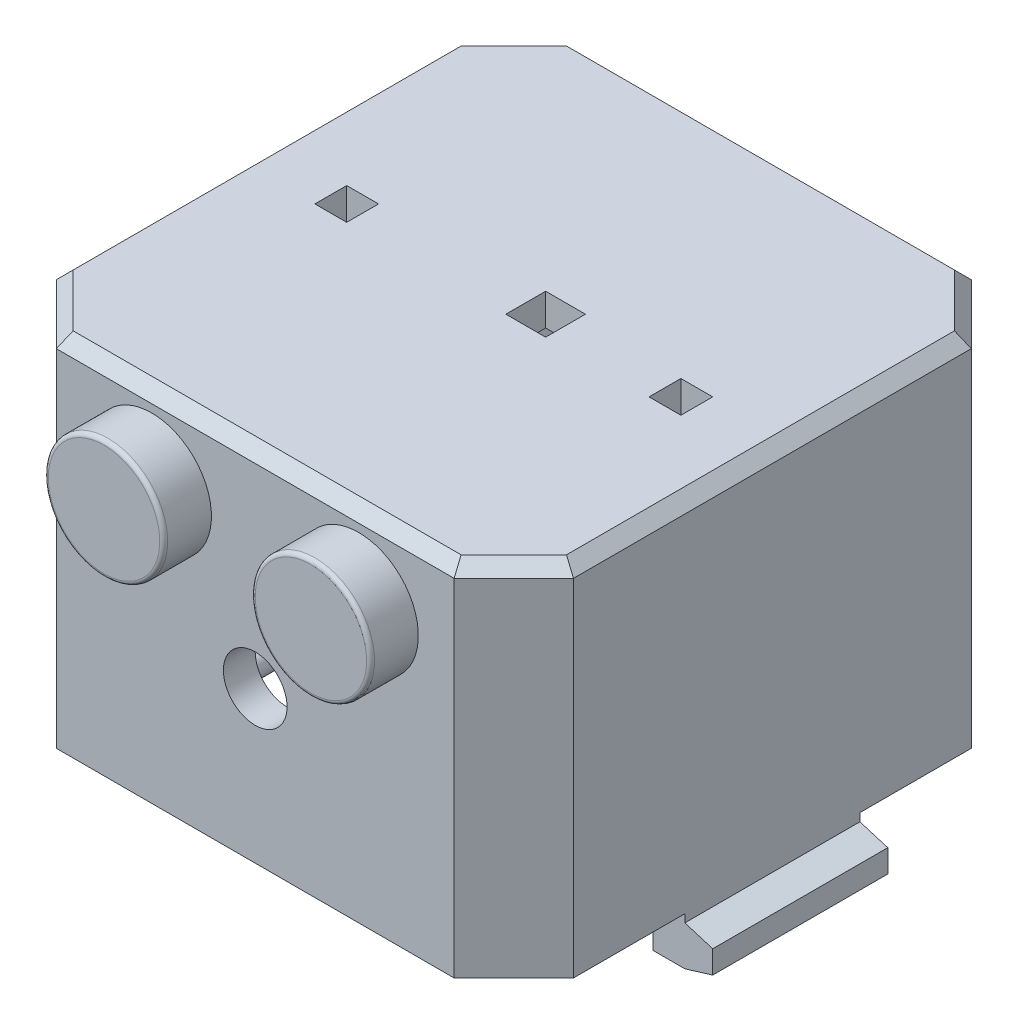
from build123d import *

# Parameters (mm, degrees)
SALIENTE_EXTRUIR1_DEPTH  = 45
VACIADO2_T               = -4
CHAFL_N3_SIZE            = 1.5
CROQUIS2_R               = 7.5
SALIENTE_EXTRUIR2_DEPTH  = 6
CROQUIS4_R               = 5
CORTAR_EXTRUIR2_DEPTH    = 8
REDONDEO1_R              = 0.5
CROQUIS5_R               = 4
CORTAR_EXTRUIR3_DEPTH    = 10
SALIENTE_EXTRUIR8_START  = 8
CROQUIS13_R              = 5
CROQUIS13_R_2            = 2.6
SALIENTE_EXTRUIR8_DEPTH  = 8
CROQUIS7_W               = 5
CROQUIS7_H               = 5
SALIENTE_EXTRUIR3_DEPTH  = 1
CROQUIS12_R              = 1.15
CROQUIS12_R_2            = 0.8
SALIENTE_EXTRUIR7_DEPTH  = 6
CROQUIS14_W              = 3
CROQUIS14_H              = 2.5
SALIENTE_EXTRUIR9_DEPTH  = 5
CROQUIS15_W              = 12
CROQUIS15_H              = 8
CORTAR_EXTRUIR6_DEPTH    = 7
CROQUIS16_W              = 14.5
CROQUIS16_H              = 14.5
CROQUIS16_W_2            = 12.4
CROQUIS16_H_2            = 12.4
SALIENTE_EXTRUIR10_DEPTH = 3
CROQUIS17_R              = 5.5
CORTAR_EXTRUIR7_DEPTH    = 88.007183611
CROQUIS18_W              = 4
CROQUIS18_H              = 22
SALIENTE_EXTRUIR11_DEPTH = 6
SALIENTE_EXTRUIR13_DEPTH = 22
CROQUIS20_W              = 5
CROQUIS20_H              = 5
CORTAR_EXTRUIR8_DEPTH    = 10
CROQUIS10_W              = 4
CROQUIS10_H              = 4
CORTAR_EXTRUIR10_DEPTH   = 74.343370525
CORTAR_EXTRUIR11_START   = -5
CROQUIS21_R              = 0.8
CORTAR_EXTRUIR11_DEPTH   = 5
CROQUIS8_R               = 1.6
SALIENTE_EXTRUIR14_DEPTH = 8


with BuildPart() as part:
    # Croquis1 → Saliente-Extruir1 (new body)
    with BuildSketch(Plane(origin=(0, 0, 0), x_dir=(1, 0, 0), z_dir=(0, 1, 0))):
        Polygon((-25, -32.5), (25, -32.5), (32.5, -25), (32.5, 25), (25, 32.5), (-25, 32.5), (-32.5, 25), (-32.5, -25), align=None)
    extrude(amount=SALIENTE_EXTRUIR1_DEPTH)

    # Vaciado2
    vaciado2_openings = [part.faces().sort_by_distance(p)[0] for p in [
        (0, 0, 0),
    ]]
    offset(amount=VACIADO2_T, openings=vaciado2_openings, kind=Kind.INTERSECTION)

    # Chaflán3
    chafl_n3_edges = [part.edges().sort_by_distance(p)[0] for p in [
        (0, 45, -32.5),
        (32.5, 45, 0),
        (0, 45, 32.5),
        (-32.5, 45, 0),
        (-28.75, 45, 28.75),
        (28.75, 45, 28.75),
        (28.75, 45, -28.75),
        (-28.75, 45, -28.75),
    ]]
    chamfer(chafl_n3_edges, length=CHAFL_N3_SIZE)

    # Croquis2 → Saliente-Extruir2 (add)
    with BuildSketch(Plane.XY.offset(32.5)):
        with Locations((13, 35)):
            Circle(CROQUIS2_R)
        with Locations((-13, 35)):
            Circle(CROQUIS2_R)
    extrude(amount=SALIENTE_EXTRUIR2_DEPTH)

    # Croquis4 → Cortar-Extruir2 (cut)
    with BuildSketch(Plane(origin=(0, 0, 28.5), x_dir=(-1, 0, 0), z_dir=(0, 0, -1))):
        with Locations((-13, 35)):
            Circle(CROQUIS4_R)
        with Locations((13, 35)):
            Circle(CROQUIS4_R)
    extrude(amount=-CORTAR_EXTRUIR2_DEPTH, mode=Mode.SUBTRACT)

    # Redondeo1
    redondeo1_edges = [part.edges().sort_by_distance(p)[0] for p in [
        (-20.5, 35, 38.5),
        (5.5, 35, 38.5),
    ]]
    fillet(redondeo1_edges, radius=REDONDEO1_R)

    # Croquis5 → Cortar-Extruir3 (cut)
    with BuildSketch(Plane.XY.offset(32.5)):
        with Locations((0, 19)):
            Circle(CROQUIS5_R)
    extrude(amount=-CORTAR_EXTRUIR3_DEPTH, mode=Mode.SUBTRACT)

    # Croquis13 → Saliente-Extruir8 (add)
    # profile 1 of 2: a face of its own
    with BuildSketch(Plane(origin=(0, 0, 36.5), x_dir=(-1, 0, 0), z_dir=(0, 0, -1)).offset(SALIENTE_EXTRUIR8_START)):
        with Locations((13, 35)):
            Circle(CROQUIS13_R)
        with Locations((13, 35)):
            Circle(CROQUIS13_R_2, mode=Mode.SUBTRACT)
    # profile 2 of 2: a face of its own
    with BuildSketch(Plane(origin=(0, 0, 36.5), x_dir=(-1, 0, 0), z_dir=(0, 0, -1)).offset(SALIENTE_EXTRUIR8_START)):
        with Locations((-13, 35)):
            Circle(CROQUIS13_R)
        with Locations((-13, 35)):
            Circle(CROQUIS13_R_2, mode=Mode.SUBTRACT)
    extrude(amount=-SALIENTE_EXTRUIR8_DEPTH)

    # Croquis7 → Saliente-Extruir3 (add)
    with BuildSketch(Plane(origin=(0, 0, 28.5), x_dir=(-1, 0, 0), z_dir=(0, 0, -1))):
        with Locations((-11.58, 10.5)):
            Rectangle(CROQUIS7_W, CROQUIS7_H)
        with Locations((-11.58, 28)):
            Rectangle(CROQUIS7_W, CROQUIS7_H)
        with Locations((11.43, 10.5)):
            Rectangle(CROQUIS7_W, CROQUIS7_H)
        with Locations((11.43, 28)):
            Rectangle(CROQUIS7_W, CROQUIS7_H)
    extrude(amount=SALIENTE_EXTRUIR3_DEPTH)

    # Croquis12 → Saliente-Extruir7 (add)
    # profile 1 of 4: a face of its own
    with BuildSketch(Plane.XZ.offset(-41)):
        with Locations((-20.65, 7.68)):
            Circle(CROQUIS12_R)
        with Locations((-20.65, 7.68)):
            Circle(CROQUIS12_R_2, mode=Mode.SUBTRACT)
    # profile 2 of 4: a face of its own
    with BuildSketch(Plane.XZ.offset(-41)):
        with Locations((-20.65, -7.68)):
            Circle(CROQUIS12_R)
        with Locations((-20.65, -7.68)):
            Circle(CROQUIS12_R_2, mode=Mode.SUBTRACT)
    # profile 3 of 4: a face of its own
    with BuildSketch(Plane.XZ.offset(-41)):
        with Locations((20.65, 7.68)):
            Circle(CROQUIS12_R)
        with Locations((20.65, 7.68)):
            Circle(CROQUIS12_R_2, mode=Mode.SUBTRACT)
    # profile 4 of 4: a face of its own
    with BuildSketch(Plane.XZ.offset(-41)):
        with Locations((20.65, -7.68)):
            Circle(CROQUIS12_R)
        with Locations((20.65, -7.68)):
            Circle(CROQUIS12_R_2, mode=Mode.SUBTRACT)
    extrude(amount=SALIENTE_EXTRUIR7_DEPTH)

    # Croquis14 → Saliente-Extruir9 (add)
    with BuildSketch(Plane.XZ.offset(-41)):
        with Locations((-20.65, 7.68)):
            Rectangle(CROQUIS14_W, CROQUIS14_H)
        with Locations((-20.65, -7.68)):
            Rectangle(CROQUIS14_W, CROQUIS14_H)
        with Locations((20.65, 7.68)):
            Rectangle(CROQUIS14_W, CROQUIS14_H)
        with Locations((20.65, -7.68)):
            Rectangle(CROQUIS14_W, CROQUIS14_H)
    extrude(amount=SALIENTE_EXTRUIR9_DEPTH)

    # Croquis15 → Cortar-Extruir6 (cut)
    with BuildSketch(Plane.ZY.offset(32.5)):
        with Locations((0, 36.5)):
            Rectangle(CROQUIS15_W, CROQUIS15_H)
    extrude(amount=-CORTAR_EXTRUIR6_DEPTH, mode=Mode.SUBTRACT)

    # Croquis16 → Saliente-Extruir10 (add)
    with BuildSketch(Plane.XY.offset(-28.5)):
        with Locations((12.75, 12.25)):
            Rectangle(CROQUIS16_W, CROQUIS16_H)
        with Locations((12.75, 12.25)):
            Rectangle(CROQUIS16_W_2, CROQUIS16_H_2, mode=Mode.SUBTRACT)
    extrude(amount=SALIENTE_EXTRUIR10_DEPTH)

    # Croquis17 → Cortar-Extruir7 (cut, through all)
    with BuildSketch(Plane.XY.offset(-28.5)):
        with Locations((12.75, 12.25)):
            Circle(CROQUIS17_R)
    extrude(amount=-CORTAR_EXTRUIR7_DEPTH, mode=Mode.SUBTRACT)

    # Croquis18 → Saliente-Extruir11 (add)
    with BuildSketch(Plane.XZ):
        with Locations((-30.5, 0)):
            Rectangle(CROQUIS18_W, CROQUIS18_H)
        with Locations((30.5, 0)):
            Rectangle(CROQUIS18_W, CROQUIS18_H)
    extrude(amount=SALIENTE_EXTRUIR11_DEPTH)

    # Croquis19 → Saliente-Extruir13 (add)
    with BuildSketch(Plane.XY.offset(11)):
        Polygon((36, -4.933333333), (36, -2.066666667), (32.5, -1), (32.5, -6), align=None)
        Polygon((-32.5, -1), (-34.5, -2.056793221), (-34.5, -4.943206779), (-32.5, -6), align=None)
    extrude(amount=-SALIENTE_EXTRUIR13_DEPTH)

    # Croquis20 → Cortar-Extruir8 (cut)
    with BuildSketch(Plane(origin=(0, 45, 0), x_dir=(1, 0, 0), z_dir=(0, 1, 0))):
        with Locations((3.50287975, 0.5)):
            Rectangle(CROQUIS20_W, CROQUIS20_H)
    extrude(amount=-CORTAR_EXTRUIR8_DEPTH, mode=Mode.SUBTRACT)

    # Croquis10 → Cortar-Extruir10 (cut, through all)
    with BuildSketch(Plane(origin=(0, 45, 0), x_dir=(1, 0, 0), z_dir=(0, 1, 0))):
        with Locations((-21, 0)):
            Rectangle(CROQUIS10_W, CROQUIS10_H)
        with Locations((21, 0)):
            Rectangle(CROQUIS10_W, CROQUIS10_H)
    extrude(amount=-CORTAR_EXTRUIR10_DEPTH, mode=Mode.SUBTRACT)

    # Croquis21 → Cortar-Extruir11 (cut)
    with BuildSketch(Plane.XZ.offset(-36).offset(CORTAR_EXTRUIR11_START)):
        with Locations((-20.65, 7.68)):
            Circle(CROQUIS21_R)
        with Locations((20.65, 7.68)):
            Circle(CROQUIS21_R)
        with Locations((20.65, -7.68)):
            Circle(CROQUIS21_R)
        with Locations((-20.65, -7.68)):
            Circle(CROQUIS21_R)
    extrude(amount=CORTAR_EXTRUIR11_DEPTH, mode=Mode.SUBTRACT)

    # Croquis8 → Saliente-Extruir14 (add)
    with BuildSketch(Plane(origin=(0, 0, 27.5), x_dir=(-1, 0, 0), z_dir=(0, 0, -1))):
        with Locations((-11.505, 10.489346828)):
            Circle(CROQUIS8_R)
        with Locations((-11.505, 27.976317365)):
            Circle(CROQUIS8_R)
        with Locations((11.505, 10.489346828)):
            Circle(CROQUIS8_R)
        with Locations((11.505, 27.976317365)):
            Circle(CROQUIS8_R)
    extrude(amount=SALIENTE_EXTRUIR14_DEPTH)


solid = part.part
